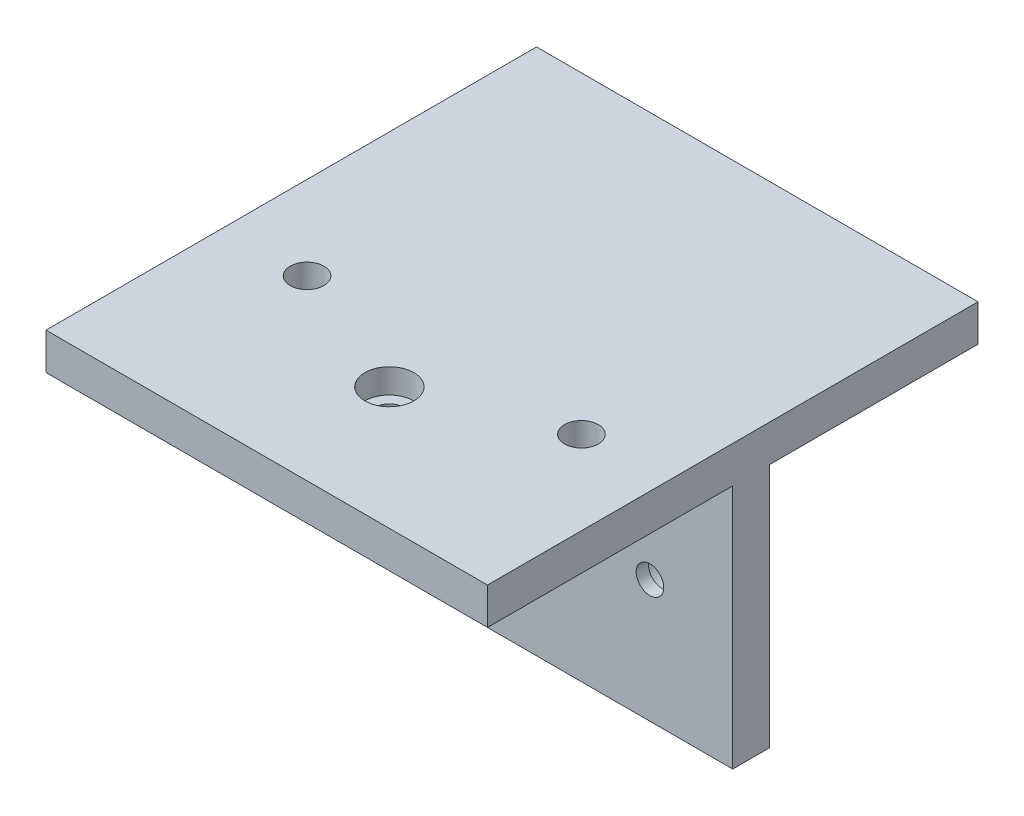
from build123d import *

# Parameters (mm, degrees)
BOSS_EXTRUDE1_DEPTH = 36
CUT_EXTRUDE1_REACH  = 65.937
SKETCH2_R           = 2.25
CUT_EXTRUDE2_REACH  = 82.598
SKETCH3_R           = 2.25
SKETCH4_R           = 4
CUT_EXTRUDE3_DEPTH  = 4
SKETCH5_R           = 4
CUT_EXTRUDE4_DEPTH  = 4
CUT_EXTRUDE5_REACH  = 85.738
SKETCH7_R           = 2.25
SKETCH8_R           = 2.75
CUT_EXTRUDE6_DEPTH  = 4


with BuildPart() as part:
    # Sketch1 → Boss-Extrude1 (new, symmetric)
    with BuildSketch(Plane(origin=(0, 0, 0), x_dir=(0, 0, -1), z_dir=(1, 0, 0))):
        Polygon((-20, 26), (-20, 20), (20, 20), (20, -20), (26, -20), (26, 20), (60, 20), (60, 26), align=None)
    extrude(amount=BOSS_EXTRUDE1_DEPTH, both=True)

    # Sketch2 → Cut-Extrude1 (cut, up to next)
    with BuildSketch(Plane(origin=(0, 0, -26), x_dir=(-1, 0, 0), z_dir=(0, 0, -1)), mode=Mode.PRIVATE) as cut_extrude1_sk1:
        with Locations((-22.5, 0)):
            Circle(SKETCH2_R)
    cut_extrude1_tool1 = extrude(cut_extrude1_sk1.sketch, amount=-CUT_EXTRUDE1_REACH, mode=Mode.PRIVATE) & part.part
    # Sketch2 → Cut-Extrude1 (cut, up to next)
    with BuildSketch(Plane(origin=(0, 0, -26), x_dir=(-1, 0, 0), z_dir=(0, 0, -1)), mode=Mode.PRIVATE) as cut_extrude1_sk2:
        with Locations((22.5, 0)):
            Circle(SKETCH2_R)
    cut_extrude1_tool2 = extrude(cut_extrude1_sk2.sketch, amount=-CUT_EXTRUDE1_REACH, mode=Mode.PRIVATE) & part.part
    add(cut_extrude1_tool1.solids().sort_by_distance((22.5, 0, -26))[0], mode=Mode.SUBTRACT)
    add(cut_extrude1_tool2.solids().sort_by_distance((-22.5, 0, -26))[0], mode=Mode.SUBTRACT)

    # Sketch3 → Cut-Extrude2 (cut, up to next)
    with BuildSketch(Plane.XZ.offset(-20), mode=Mode.PRIVATE) as cut_extrude2_sk1:
        Circle(SKETCH3_R)
    cut_extrude2_tool1 = extrude(cut_extrude2_sk1.sketch, amount=-CUT_EXTRUDE2_REACH, mode=Mode.PRIVATE) & part.part
    add(cut_extrude2_tool1.solids().sort_by_distance((0, 20, 0))[0], mode=Mode.SUBTRACT)

    # Sketch4 → Cut-Extrude3 (cut)
    with BuildSketch(Plane(origin=(0, 0, -26), x_dir=(-1, 0, 0), z_dir=(0, 0, -1))):
        with Locations((-22.5, 0)):
            Circle(SKETCH4_R)
        with Locations((22.5, 0)):
            Circle(SKETCH4_R)
    extrude(amount=-CUT_EXTRUDE3_DEPTH, mode=Mode.SUBTRACT)

    # Sketch5 → Cut-Extrude4 (cut)
    with BuildSketch(Plane(origin=(0, 26, 0), x_dir=(1, 0, 0), z_dir=(0, 1, 0))):
        Circle(SKETCH5_R)
    extrude(amount=-CUT_EXTRUDE4_DEPTH, mode=Mode.SUBTRACT)

    # Sketch7 → Cut-Extrude5 (cut, up to next)
    with BuildSketch(Plane(origin=(0, 26, 0), x_dir=(1, 0, 0), z_dir=(0, 1, 0)), mode=Mode.PRIVATE) as cut_extrude5_sk1:
        with Locations((-22.375, 8.95)):
            Circle(SKETCH7_R)
    cut_extrude5_tool1 = extrude(cut_extrude5_sk1.sketch, amount=-CUT_EXTRUDE5_REACH, mode=Mode.PRIVATE) & part.part
    # Sketch7 → Cut-Extrude5 (cut, up to next)
    with BuildSketch(Plane(origin=(0, 26, 0), x_dir=(1, 0, 0), z_dir=(0, 1, 0)), mode=Mode.PRIVATE) as cut_extrude5_sk2:
        with Locations((22.375, 8.95)):
            Circle(SKETCH7_R)
    cut_extrude5_tool2 = extrude(cut_extrude5_sk2.sketch, amount=-CUT_EXTRUDE5_REACH, mode=Mode.PRIVATE) & part.part
    add(cut_extrude5_tool1.solids().sort_by_distance((-22.375, 26, -8.95))[0], mode=Mode.SUBTRACT)
    add(cut_extrude5_tool2.solids().sort_by_distance((22.375, 26, -8.95))[0], mode=Mode.SUBTRACT)

    # Sketch8 → Cut-Extrude6 (cut)
    with BuildSketch(Plane(origin=(0, 26, 0), x_dir=(1, 0, 0), z_dir=(0, 1, 0))):
        with Locations((-22.375, 8.95)):
            Circle(SKETCH8_R)
        with Locations((22.375, 8.95)):
            Circle(SKETCH8_R)
    extrude(amount=-CUT_EXTRUDE6_DEPTH, mode=Mode.SUBTRACT)


solid = part.part
